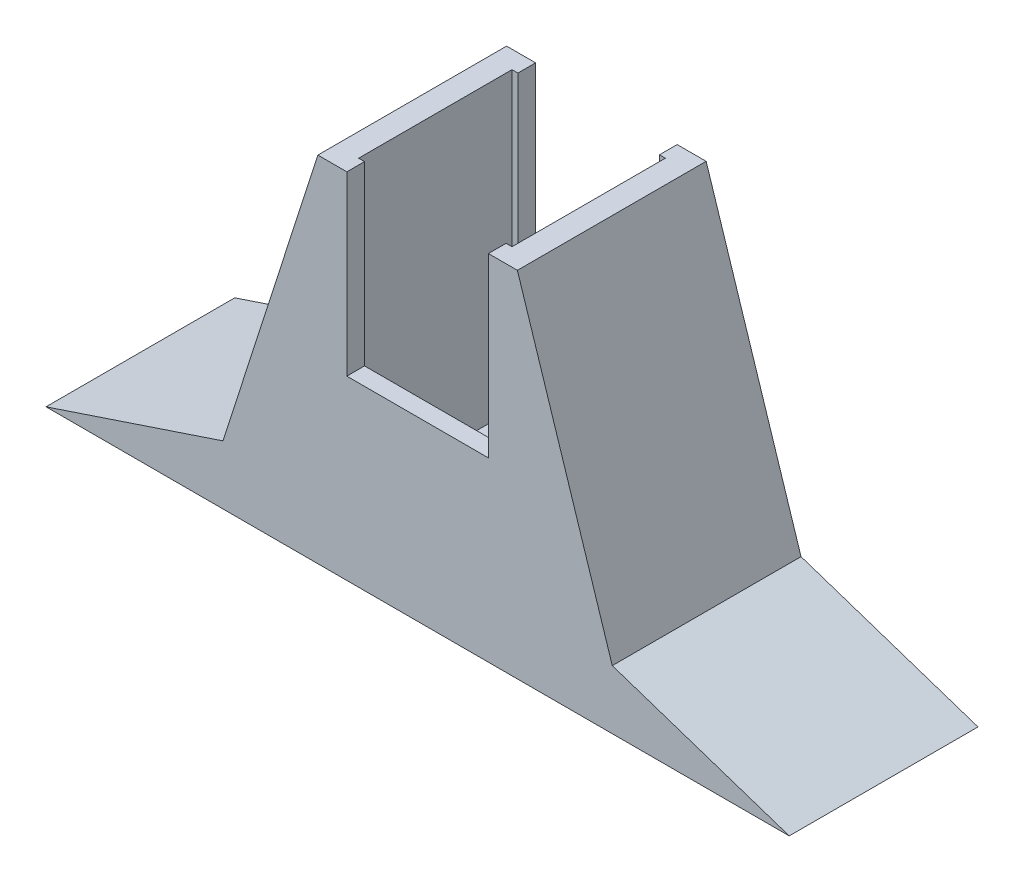
from build123d import *

# Parameters (mm, degrees)
EXTRUDE_2_DEPTH     = 16
SKETCH_3_W          = 13
SKETCH_3_H          = 13
CUT_EXTRUDE_3_DEPTH = 25
SKETCH_6_W          = 12
SKETCH_6_H          = 15
CUT_EXTRUDE_4_DEPTH = 25
EXTRUDE_3_DEPTH     = 16


with BuildPart() as part:
    # 스케치1 → 보스-돌출2 (new body)
    with BuildSketch(Plane.XY):
        Polygon((31.5, 0), (-31.5, 0), (-16.5, 5), (-11.5, 10), (-8.457539251, 30), (8.457539251, 30), (11.5, 10), (16.5, 5), align=None)
    extrude(amount=EXTRUDE_2_DEPTH)

    # 스케치3 → 컷-돌출3 (cut)
    with BuildSketch(Plane(origin=(0, 30, 0), x_dir=(1, 0, 0), z_dir=(0, 1, 0))):
        with Locations((0, -8)):
            Rectangle(SKETCH_3_W, SKETCH_3_H)
    extrude(amount=-CUT_EXTRUDE_3_DEPTH, mode=Mode.SUBTRACT)

    # 스케치6 → 컷-돌출4 (cut)
    with BuildSketch(Plane.XY.offset(16)):
        with Locations((0, 22.5)):
            Rectangle(SKETCH_6_W, SKETCH_6_H)
    extrude(amount=-CUT_EXTRUDE_4_DEPTH, mode=Mode.SUBTRACT)

    # 스케치7 → 보스-돌출3 (add)
    with BuildSketch(Plane.XY.offset(16)):
        Polygon((-16.5, 5), (-8.457539251, 30), (-11.5, 10), align=None)
        Polygon((8.457539251, 30), (11.5, 10), (16.5, 5), align=None)
    extrude(amount=-EXTRUDE_3_DEPTH)


solid = part.part
